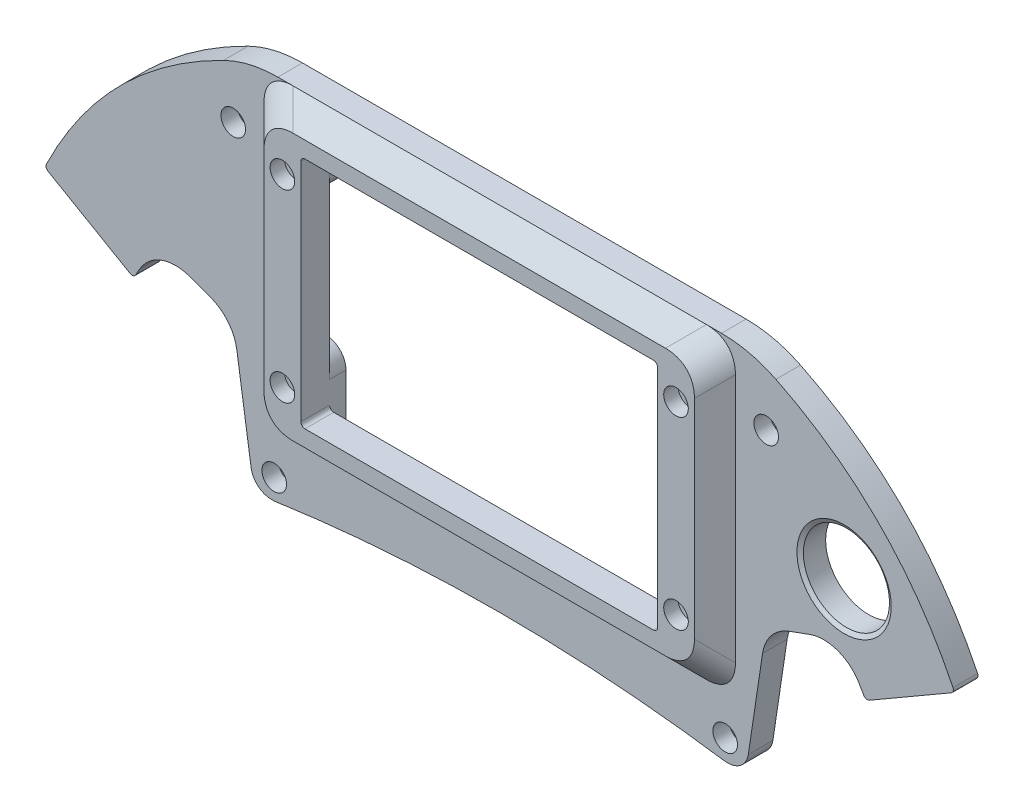
from build123d import *

# Parameters (mm, degrees)
SKETCH_8_W           = 105
SKETCH_8_H           = 70
EXTRUDE_1_DEPTH      = 6
EXTRUDE_2_DEPTH      = 7
EXTRUDE_2_DEPTH_BACK = 2
SKETCH_12_W          = 109
SKETCH_12_H          = 74
SKETCH_12_W_2        = 85
SKETCH_12_H_2        = 55
CUT_EXTRUDE_1_DEPTH  = 7
CUT_EXTRUDE_2_DEPTH  = 7
SKETCH_14_R          = 1.75
CUT_EXTRUDE_4_DEPTH  = 100
SKETCH_16_R          = 3
CUT_EXTRUDE_5_DEPTH  = 3.5
SKETCH_17_W          = 9
SKETCH_17_H          = 8
CUT_EXTRUDE_6_DEPTH  = 3
SKETCH_18_R          = 2.6
CUT_EXTRUDE_7_DEPTH  = 3
SKETCH_25_W          = 1
SKETCH_25_H          = 8
CUT_EXTRUDE_14_DEPTH = 7
SKETCH_26_W          = 87
SKETCH_26_H          = 57
CUT_EXTRUDE_15_DEPTH = 7
EXTRUDE_3_DEPTH      = 6
SKETCH_30_R          = 3
CUT_EXTRUDE_16_DEPTH = 4
SKETCH_31_R          = 1.75
CUT_EXTRUDE_17_DEPTH = 50
CUT_EXTRUDE_18_DEPTH = 10
SKETCH_38_W          = 306.867887418
SKETCH_38_H          = 124.183206552
CUT_EXTRUDE_19_DEPTH = 10
SKETCH_39_W          = 105
SKETCH_39_H          = 70
EXTRUDE_4_DEPTH      = 8
FILLET_1_R           = 10
SKETCH_44_W          = 87
SKETCH_44_H          = 57
CUT_EXTRUDE_21_DEPTH = 154.324551706
SKETCH_45_R          = 1.75
CUT_EXTRUDE_23_DEPTH = 154.167941026
SKETCH_46_R          = 3
CUT_EXTRUDE_24_DEPTH = 3.5
SKETCH_47_R          = 10.5
CUT_EXTRUDE_25_DEPTH = 154.167941026
CUT_EXTRUDE_26_DEPTH = 4
CUT_EXTRUDE_27_DEPTH = 4
FILLET_2_R           = 30
FILLET_3_R           = 10
FILLET_4_R           = 1
FILLET_5_R           = 5
FILLET_7_R           = 1
FILLET_8_R           = 10
CUT_EXTRUDE_28_DEPTH = 15
SKETCH_55_W          = 151.974091765
SKETCH_55_H          = 109.196199268
CUT_EXTRUDE_29_DEPTH = 10
CHAMFER_1_SIZE       = 1
CHAMFER_1_SIZE2      = 0.577350269


with BuildPart() as part:
    # ｽｹｯﾁ8 → ﾎﾞｽ - 押し出し1 (new body)
    with BuildSketch(Plane.XY):
        with BuildLine():
            Line((-60, 15), (-65, 48.260557735))
            Line((-65, 48.260557735), (-83.516465442, 55))
            Line((-83.516465442, 55), (-89.302855497, 45))
            Line((-89.302855497, 45), (-110.970347899, 57.537656255))
            add(Edge.make_bspline(
                [(-110.970347899, 57.537656255), (-95.100233904, 90.835498348), (-60.5, 105)],
                knots=[0, 0, 0, 1, 1, 1], degree=2))
            Line((-60.5, 105), (60.5, 105))
            add(Edge.make_bspline(
                [(110.970347899, 57.537656255), (95.100233904, 90.835498348), (60.5, 105)],
                knots=[0, 0, 0, 1, 1, 1], degree=2))
            Line((110.970347899, 57.537656255), (89.302855497, 45))
            Line((89.302855497, 45), (83.516465442, 55))
            Line((83.516465442, 55), (65, 48.260557735))
            Line((65, 48.260557735), (60, 15))
            Line((60, 15), (30, 10))
            Line((30, 10), (26.650635095, 10))
            Line((26.650635095, 10), (26.650635095, 12.5))
            ThreePointArc((26.650635095, 12.5), (21.650635095, 17.5), (16.650635095, 12.5))
            Line((16.650635095, 12.5), (16.650635095, 10))
            Line((16.650635095, 10), (-16.650635095, 10))
            Line((-16.650635095, 10), (-16.650635095, 12.5))
            ThreePointArc((-16.650635095, 12.5), (-21.650635095, 17.5), (-26.650635095, 12.5))
            Line((-26.650635095, 12.5), (-26.650635095, 10))
            Line((-26.650635095, 10), (-30, 10))
            Line((-30, 10), (-60, 15))
        make_face()
        with Locations((0, 63)):
            Rectangle(SKETCH_8_W, SKETCH_8_H, mode=Mode.SUBTRACT)
    extrude(amount=EXTRUDE_1_DEPTH)

    # ｽｹｯﾁ12 → ﾎﾞｽ - 押し出し2 (add, two sides: drawn at the far end of the back side and taken through both)
    with BuildSketch(Plane.XY.offset(6).offset(-EXTRUDE_2_DEPTH_BACK)):
        with Locations((0, 63)):
            Rectangle(SKETCH_12_W, SKETCH_12_H)
        with Locations((0, 67.5)):
            Rectangle(SKETCH_12_W_2, SKETCH_12_H_2, mode=Mode.SUBTRACT)
    extrude(amount=EXTRUDE_2_DEPTH + EXTRUDE_2_DEPTH_BACK)

    # ｽｹｯﾁ13 → ｶｯﾄ - 押し出し1 (cut)
    with BuildSketch(Plane.XY.offset(13)):
        Polygon((-58.5, 77.039073902), (-58.5, 25.039073902), (-48.5, 25.039073902), (-48.5, 65.121537976), align=None)
        Polygon((58.5, 77.039073902), (58.5, 25.039073902), (48.5, 25.039073902), (48.5, 65.121537976), align=None)
    extrude(amount=-CUT_EXTRUDE_1_DEPTH, mode=Mode.SUBTRACT)

    # ｽｹｯﾁ15 → ｶｯﾄ - 押し出し2 (cut)
    with BuildSketch(Plane(origin=(0, 0, 4), x_dir=(-1, 0, 0), z_dir=(0, 0, -1))):
        Polygon((-52.5, 80), (-43.5, 80), (-43.5, 72), (-51.660900369, 72), (-46.5, 65.849478444), (-46.5, 28), (46.5, 28), (46.5, 65.849478444), (51.660900369, 72), (42.5, 72), (42.5, 80), (52.5, 80), (52.5, 98), (-52.5, 98), align=None)
    extrude(amount=-CUT_EXTRUDE_2_DEPTH, mode=Mode.SUBTRACT)

    # ｽｹｯﾁ14 → ｶｯﾄ - 押し出し4 (cut)
    with BuildSketch(Plane.XY):
        with Locations((48.5, 76)):
            Circle(SKETCH_14_R)
        with Locations((-48.5, 76)):
            Circle(SKETCH_14_R)
    extrude(amount=CUT_EXTRUDE_4_DEPTH, mode=Mode.SUBTRACT)

    # ｽｹｯﾁ16 → ｶｯﾄ - 押し出し5 (cut)
    with BuildSketch(Plane.XY.offset(13)):
        with Locations((48.5, 76)):
            Circle(SKETCH_16_R)
        with Locations((-48.5, 76)):
            Circle(SKETCH_16_R)
    extrude(amount=-CUT_EXTRUDE_5_DEPTH, mode=Mode.SUBTRACT)

    # ｽｹｯﾁ17 → ｶｯﾄ - 押し出し6 (cut)
    with BuildSketch(Plane(origin=(0, 0, 4), x_dir=(-1, 0, 0), z_dir=(0, 0, -1))):
        with Locations((-48, 76)):
            Rectangle(SKETCH_17_W, SKETCH_17_H)
        with Locations((48, 76)):
            Rectangle(SKETCH_17_W, SKETCH_17_H)
    extrude(amount=-CUT_EXTRUDE_6_DEPTH, mode=Mode.SUBTRACT)

    # ｽｹｯﾁ18 → ｶｯﾄ - 押し出し7 (cut)
    with BuildSketch(Plane(origin=(0, 0, 11), x_dir=(-1, 0, 0), z_dir=(0, 0, -1))):
        with Locations((-41.25, 92)):
            Circle(SKETCH_18_R)
        with Locations((-33.75, 92)):
            Circle(SKETCH_18_R)
        with Locations((-26.25, 92)):
            Circle(SKETCH_18_R)
        with Locations((-18.75, 92)):
            Circle(SKETCH_18_R)
        with Locations((-11.25, 92)):
            Circle(SKETCH_18_R)
        with Locations((-3.75, 92)):
            Circle(SKETCH_18_R)
        with Locations((3.75, 92)):
            Circle(SKETCH_18_R)
        with Locations((11.25, 92)):
            Circle(SKETCH_18_R)
        with Locations((18.75, 92)):
            Circle(SKETCH_18_R)
        with Locations((26.25, 92)):
            Circle(SKETCH_18_R)
        with Locations((33.75, 92)):
            Circle(SKETCH_18_R)
        with Locations((41.25, 92)):
            Circle(SKETCH_18_R)
    extrude(amount=-CUT_EXTRUDE_7_DEPTH, mode=Mode.SUBTRACT)

    # ｽｹｯﾁ25 → ｶｯﾄ - 押し出し14 (cut)
    with BuildSketch(Plane(origin=(0, 0, 4), x_dir=(-1, 0, 0), z_dir=(0, 0, -1))):
        with Locations((43, 76)):
            Rectangle(SKETCH_25_W, SKETCH_25_H)
    extrude(amount=-CUT_EXTRUDE_14_DEPTH, mode=Mode.SUBTRACT)

    # ｽｹｯﾁ26 → ｶｯﾄ - 押し出し15 (cut)
    with BuildSketch(Plane.XY.offset(13)):
        with Locations((0, 67.5)):
            Rectangle(SKETCH_26_W, SKETCH_26_H)
    extrude(amount=-CUT_EXTRUDE_15_DEPTH, mode=Mode.SUBTRACT)

    # ｽｹｯﾁ27 → ﾎﾞｽ - 押し出し3 (add)
    with BuildSketch(Plane(origin=(0, 0, 4), x_dir=(-1, 0, 0), z_dir=(0, 0, -1))):
        Polygon((-52.5, 72), (-51.660900369, 72), (-46.5, 65.849478444), (-46.5, 28), (-52.5, 28), align=None)
        Polygon((46.5, 28), (52.5, 28), (52.5, 72), (51.660900369, 72), (46.5, 65.849478444), align=None)
    extrude(amount=EXTRUDE_3_DEPTH)

    # ｽｹｯﾁ30 → ｶｯﾄ - 押し出し16 (cut)
    with BuildSketch(Plane.XY.offset(6)):
        with Locations((-65, 90)):
            Circle(SKETCH_30_R)
        with Locations((-55, 20)):
            Circle(SKETCH_30_R)
        with Locations(Location((55, 20, 0), (0, 0, 180))):
            Circle(SKETCH_30_R)
        with Locations(Location((65, 90, 0), (0, 0, 180))):
            Circle(SKETCH_30_R)
    extrude(amount=-CUT_EXTRUDE_16_DEPTH, mode=Mode.SUBTRACT)

    # ｽｹｯﾁ31 → ｶｯﾄ - 押し出し17 (cut)
    with BuildSketch(Plane.XY.offset(6)):
        with Locations((-65, 90)):
            Circle(SKETCH_31_R)
        with Locations((-55, 20)):
            Circle(SKETCH_31_R)
        with Locations((55, 20)):
            Circle(SKETCH_31_R)
        with Locations((65, 90)):
            Circle(SKETCH_31_R)
    extrude(amount=-CUT_EXTRUDE_17_DEPTH, mode=Mode.SUBTRACT)

    # ｽｹｯﾁ37 → ｶｯﾄ - 押し出し18 (cut)
    with BuildSketch(Plane.XY.offset(6)):
        Polygon((-60, 15), (-30, 15), (-28.556624327, 17.5), (28.556624327, 17.5), (30, 15), (60, 15), (60, 0), (-60, 0), align=None)
    extrude(amount=-CUT_EXTRUDE_18_DEPTH, mode=Mode.SUBTRACT)

    # ｽｹｯﾁ38 → ｶｯﾄ - 押し出し19 (cut)
    with BuildSketch(Plane.XY.offset(6)):
        with Locations((0, 67.5)):
            Rectangle(SKETCH_38_W, SKETCH_38_H)
    extrude(amount=CUT_EXTRUDE_19_DEPTH, mode=Mode.SUBTRACT)

    # ｽｹｯﾁ39 → ﾎﾞｽ - 押し出し4 (add)
    with BuildSketch(Plane.XY.offset(6)):
        with Locations((0, 63)):
            Rectangle(SKETCH_39_W, SKETCH_39_H)
    extrude(amount=-EXTRUDE_4_DEPTH)

    # ｽｹｯﾁ43 → ﾛﾌﾄ1 section 0
    with BuildSketch(Plane.XY.offset(11)):
        with BuildLine():
            Line((52.5, 100), (-52.5, 100))
            Line((-52.5, 100), (-52.5, 35))
            Line((-52.5, 35), (52.5, 35))
            Line((52.5, 35), (52.5, 100))
        make_face()
    # ｽｹｯﾁ42 → ﾛﾌﾄ1 section 1
    with BuildSketch(Plane.XY.offset(6)):
        with BuildLine():
            Line((-57.5, 105), (57.5, 105))
            Line((57.5, 105), (57.5, 30))
            Line((57.5, 30), (-57.5, 30))
            Line((-57.5, 30), (-57.5, 105))
        make_face()
    loft()

    # ﾌｨﾚｯﾄ1
    fillet_1_edges = [part.edges().sort_by_distance(p)[0] for p in [
        (-55, 32.5, 8.5),
        (55, 32.5, 8.5),
        (55, 102.5, 8.5),
        (-55, 102.5, 8.5),
    ]]
    fillet(fillet_1_edges, radius=FILLET_1_R)

    # ｽｹｯﾁ44 → ｶｯﾄ - 押し出し21 (cut, through all)
    with BuildSketch(Plane.XY.offset(11)):
        with Locations((0, 67.5)):
            Rectangle(SKETCH_44_W, SKETCH_44_H)
    extrude(amount=-CUT_EXTRUDE_21_DEPTH, mode=Mode.SUBTRACT)

    # ｽｹｯﾁ45 → ｶｯﾄ - 押し出し23 (cut, through all)
    with BuildSketch(Plane.XY):
        with Locations(Location((-48, 90, 0), (0, 0, 180))):
            Circle(SKETCH_45_R)
        with Locations(Location((-48, 45, 0), (0, 0, 180))):
            Circle(SKETCH_45_R)
        with Locations(Location((48, 45, 0), (0, 0, 180))):
            Circle(SKETCH_45_R)
        with Locations(Location((48, 90, 0), (0, 0, 180))):
            Circle(SKETCH_45_R)
    extrude(amount=CUT_EXTRUDE_23_DEPTH, mode=Mode.SUBTRACT)

    # ｽｹｯﾁ46 → ｶｯﾄ - 押し出し24 (cut)
    with BuildSketch(Plane.XY.offset(11)):
        with Locations((-48, 90)):
            Circle(SKETCH_46_R)
        with Locations((-48, 45)):
            Circle(SKETCH_46_R)
        with Locations(Location((48, 45, 0), (0, 0, 180))):
            Circle(SKETCH_46_R)
        with Locations(Location((48, 90, 0), (0, 0, 180))):
            Circle(SKETCH_46_R)
    extrude(amount=-CUT_EXTRUDE_24_DEPTH, mode=Mode.SUBTRACT)

    # ｽｹｯﾁ47 → ｶｯﾄ - 押し出し25 (cut, through all)
    with BuildSketch(Plane(origin=(0, 0, 0), x_dir=(-1, 0, 0), z_dir=(0, 0, -1))):
        with Locations((-84, 68)):
            Circle(SKETCH_47_R)
    extrude(amount=-CUT_EXTRUDE_25_DEPTH, mode=Mode.SUBTRACT)

    # ｽｹｯﾁ48 → ｶｯﾄ - 押し出し26 (cut)
    with BuildSketch(Plane(origin=(0, 0, 0), x_dir=(-1, 0, 0), z_dir=(0, 0, -1))):
        with BuildLine():
            Line((-84, 80.5), (-84, 84))
            Line((-84, 84), (-43.5, 84))
            Line((-43.5, 84), (-43.5, 51))
            Line((-43.5, 51), (-63.755142564, 51))
            Line((-63.755142564, 51), (-78.993613928, 56.546349992))
            ThreePointArc((-78.993613928, 56.546349992), (-71.764383442, 70.557281262), (-84, 80.5))
        make_face()
        Polygon((43.5, 84), (83.5, 84), (90.519056293, 81.831052544), (106.6531152, 58.505573356), (90.396972403, 49.099135055), (84.853572805, 58.679200597), (62.195364621, 50.432287257), (57.5, 50.432287257), (43.5, 50.432287257), align=None)
    extrude(amount=-CUT_EXTRUDE_26_DEPTH, mode=Mode.SUBTRACT)

    # ｽｹｯﾁ49 → ｶｯﾄ - 押し出し27 (cut)
    with BuildSketch(Plane(origin=(0, 0, 0), x_dir=(-1, 0, 0), z_dir=(0, 0, -1))):
        Polygon((-43.5, 96), (-43.5, 101), (43.5, 101), (43.5, 21.5), (-43.5, 21.5), align=None)
    extrude(amount=-CUT_EXTRUDE_27_DEPTH, mode=Mode.SUBTRACT)

    # ﾌｨﾚｯﾄ2
    fillet_2_edges = [part.edges().sort_by_distance(p)[0] for p in [
        (60.5, 105, 3),
        (-60.5, 105, 3),
    ]]
    fillet(fillet_2_edges, radius=FILLET_2_R)

    # ﾌｨﾚｯﾄ3
    fillet_3_edges = [part.edges().sort_by_distance(p)[0] for p in [
        (83.516465442, 55, 3),
        (65, 48.260557735, 3),
        (-65, 48.260557735, 3),
        (-83.516465442, 55, 3),
    ]]
    fillet(fillet_3_edges, radius=FILLET_3_R)

    # ﾌｨﾚｯﾄ4
    fillet_4_edges = [part.edges().sort_by_distance(p)[0] for p in [
        (110.970347899, 57.537656255, 3),
        (89.302855497, 45, 3),
        (-89.302855497, 45, 3),
        (-110.970347899, 57.537656255, 3),
        (43.5, 96, 7.5),
        (43.5, 39, 7.5),
        (-43.5, 39, 7.5),
        (-43.5, 96, 7.5),
    ]]
    fillet(fillet_4_edges, radius=FILLET_4_R)

    # ﾌｨﾚｯﾄ5
    # the kernel refuses this fillet: 5 mm, written as the material it adds along each edge
    with BuildSketch(Plane(origin=(43.5, 21.5, 0), x_dir=(-1, 0, 0), z_dir=(0, 0, 1)), Plane(origin=(-43.5, 101, 0), x_dir=(1, 0, 0), z_dir=(0, 0, 1)), Plane(origin=(-43.5, 21.5, 0), x_dir=(0, 1, 0), z_dir=(0, 0, 1))) as fillet_5_piece_1:
        with BuildLine():
            CenterArc((FILLET_5_R, -FILLET_5_R), FILLET_5_R, 90, 90)
            Line((0, -FILLET_5_R), (0, 0))
            Line((0, 0), (FILLET_5_R, 0))
        make_face()
    extrude(amount=4)
    with BuildSketch(Plane(origin=(43.5, 101, 0), x_dir=(-1, 0, 0), z_dir=(0, 0, 1))) as fillet_5_piece_2:
        with BuildLine():
            CenterArc((FILLET_5_R, FILLET_5_R), FILLET_5_R, 180, 90)
            Line((0, FILLET_5_R), (0, 0))
            Line((0, 0), (FILLET_5_R, 0))
        make_face()
    extrude(amount=4)
    # the kernel refuses this fillet: 5 mm, written as the material it takes off along each edge
    with BuildSketch(Plane(origin=(60, 15, -10.761349406), x_dir=(-1, 0, 0), z_dir=(0, 0, 1)), Plane(origin=(-60, 15, -10.761349406), x_dir=(-0.1486578633311447, 0.9888886892212988, 0), z_dir=(0, 0, 1))) as fillet_5_2_piece_1:
        with BuildLine():
            CenterArc((FILLET_5_R * 0.860907952481, -FILLET_5_R), FILLET_5_R, 90, 81.450844213)
            Line((-FILLET_5_R * 0.127980736741, -FILLET_5_R * 0.851342136669), (0, 0))
            Line((0, 0), (FILLET_5_R * 0.860907952481, 0))
        make_face()
    extrude(amount=27.522698812, mode=Mode.SUBTRACT)
    with BuildSketch(Plane(origin=(43.5, 84, 0), x_dir=(0, 1, 0), z_dir=(0, 0, 1)), Plane(origin=(43.5, 51, 0), x_dir=(1, 0, 0), z_dir=(0, 0, 1)), Plane(origin=(-43.5, 50.432287257, 0), x_dir=(0, -1, 0), z_dir=(0, 0, 1))) as fillet_5_2_piece_2:
        with BuildLine():
            CenterArc((FILLET_5_R, -FILLET_5_R), FILLET_5_R, 90, 90)
            Line((0, -FILLET_5_R), (0, 0))
            Line((0, 0), (FILLET_5_R, 0))
        make_face()
    extrude(amount=4, mode=Mode.SUBTRACT)
    with BuildSketch(Plane(origin=(-43.5, 84, 0), x_dir=(0, 1, 0), z_dir=(0, 0, 1))) as fillet_5_2_piece_3:
        with BuildLine():
            CenterArc((FILLET_5_R, FILLET_5_R), FILLET_5_R, 180, 90)
            Line((0, FILLET_5_R), (0, 0))
            Line((0, 0), (FILLET_5_R, 0))
        make_face()
    extrude(amount=4, mode=Mode.SUBTRACT)

    # ﾌｨﾚｯﾄ7
    fillet_7_edges = [part.edges().sort_by_distance(p)[0] for p in [
        (-30, 15, 3),
        (-28.556624327, 17.5, 3),
        (28.556624327, 17.5, 3),
        (30, 15, 3),
    ]]
    fillet(fillet_7_edges, radius=FILLET_7_R)

    # ﾌｨﾚｯﾄ8
    fillet_8_edges = [part.edges().sort_by_distance(p)[0] for p in [
        (-84.853572805, 58.679200597, 2),
    ]]
    fillet(fillet_8_edges, radius=FILLET_8_R)

    # ｽｹｯﾁ53 → ｶｯﾄ - 押し出し28 (cut)
    with BuildSketch(Plane.XY.offset(6)):
        with BuildLine():
            Line((-55, 15), (55, 15))
            add(Edge.make_bspline(
                [(55, 15), (36.769552059, 17.647364526), (18.436218933, 18.976512989), (0, 18.976512989)],
                knots=[0, 0, 0, 0, 1, 1, 1, 1], degree=3))
            add(Edge.make_bspline(
                [(-55, 15), (-36.769552059, 17.647364526), (-18.436218933, 18.976512989), (0, 18.976512989)],
                knots=[0, 0, 0, 0, 1, 1, 1, 1], degree=3))
        make_face()
    extrude(amount=-CUT_EXTRUDE_28_DEPTH, mode=Mode.SUBTRACT)

    # ｽｹｯﾁ55 → ｶｯﾄ - 押し出し29 (cut)
    with BuildSketch(Plane(origin=(0, 0, 0), x_dir=(-1, 0, 0), z_dir=(0, 0, -1))):
        with Locations((2.421819381, 65.877084913)):
            Rectangle(SKETCH_55_W, SKETCH_55_H)
    extrude(amount=CUT_EXTRUDE_29_DEPTH, mode=Mode.SUBTRACT)

    # 面取り1
    chamfer_1_edges = [part.edges().sort_by_distance(p)[0] for p in [
        (94.5, 68, 6),
    ]]
    chamfer_1_side = [part.faces().sort_by_distance(p)[0] for p in [
        (-55.347730119, 15.238932439, 6),
    ]]
    chamfer(chamfer_1_edges, length=CHAMFER_1_SIZE, length2=CHAMFER_1_SIZE2, reference=chamfer_1_side[0])


solid = part.part
